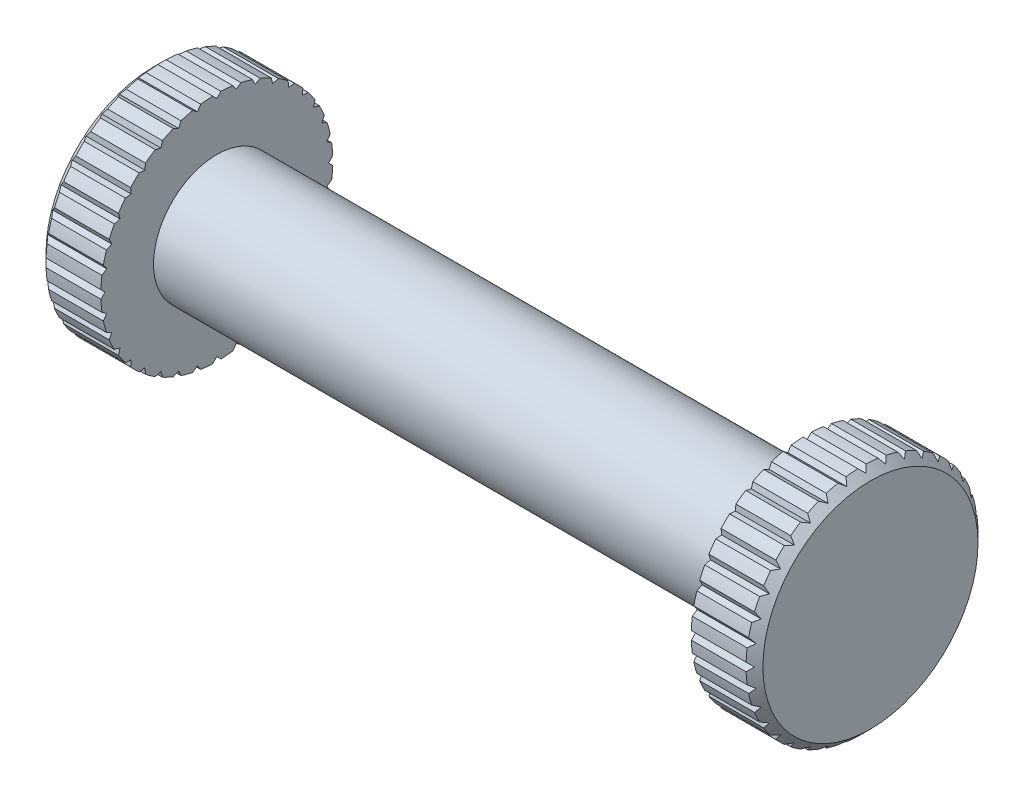
from build123d import *

# Parameters (mm, degrees)
SKETCH1_R           = 1.5
BOSS_EXTRUDE1_DEPTH = 7
SKETCH2_R           = 2.75
BOSS_EXTRUDE2_DEPTH = 1.5
CHAMFER1_SIZE       = 0.2
CUT_EXTRUDE1_DEPTH  = 1.5
CIRPATTERN1_COUNT   = 36


# Read off the part's stored shape, not the designer's step: Mirror1
with BuildPart() as part:
    # Sketch1 → Boss-Extrude1 (new, symmetric)
    with BuildSketch(Plane(origin=(0, 0, 0), x_dir=(0, 0, -1), z_dir=(1, 0, 0))):
        Circle(SKETCH1_R)
    extrude(amount=BOSS_EXTRUDE1_DEPTH, both=True)

    # Sketch2 → Boss-Extrude2 (add)
    with BuildSketch(Plane(origin=(7, 0, 0), x_dir=(0, 0, -1), z_dir=(1, 0, 0))):
        Circle(SKETCH2_R)
    extrude(amount=BOSS_EXTRUDE2_DEPTH)

    # Chamfer1
    chamfer1_edges = [part.edges().sort_by_distance(p)[0] for p in [
        (8.5, 0, 2.75),
    ]]
    chamfer(chamfer1_edges, length=CHAMFER1_SIZE)

    # Sketch3 → Cut-Extrude1 (cut)
    with BuildSketch(Plane(origin=(8.5, 0, 0), x_dir=(0, 0, -1), z_dir=(1, 0, 0))):
        Polygon((-0.1, 2.75), (0.1, 2.75), (0, 2.65), align=None)
    cut_extrude1 = extrude(amount=-CUT_EXTRUDE1_DEPTH, mode=Mode.SUBTRACT)

    # CirPattern1: Cut-Extrude1 ×36 about axis
    cirpattern1_axis = Axis((0, 0, 0), (1, 0, 0))
    for i in range(1, CIRPATTERN1_COUNT):
        add(cut_extrude1.rotate(cirpattern1_axis, i * 360 / CIRPATTERN1_COUNT), mode=Mode.SUBTRACT)

    # Mirror1: part across plane


with BuildPart() as part_1:
    add(part.part)
    add(part.part.mirror(Plane(origin=(0, 0, 0), x_dir=(0, 0, 1), z_dir=(1, 0, 0))))


solid = part_1.part
